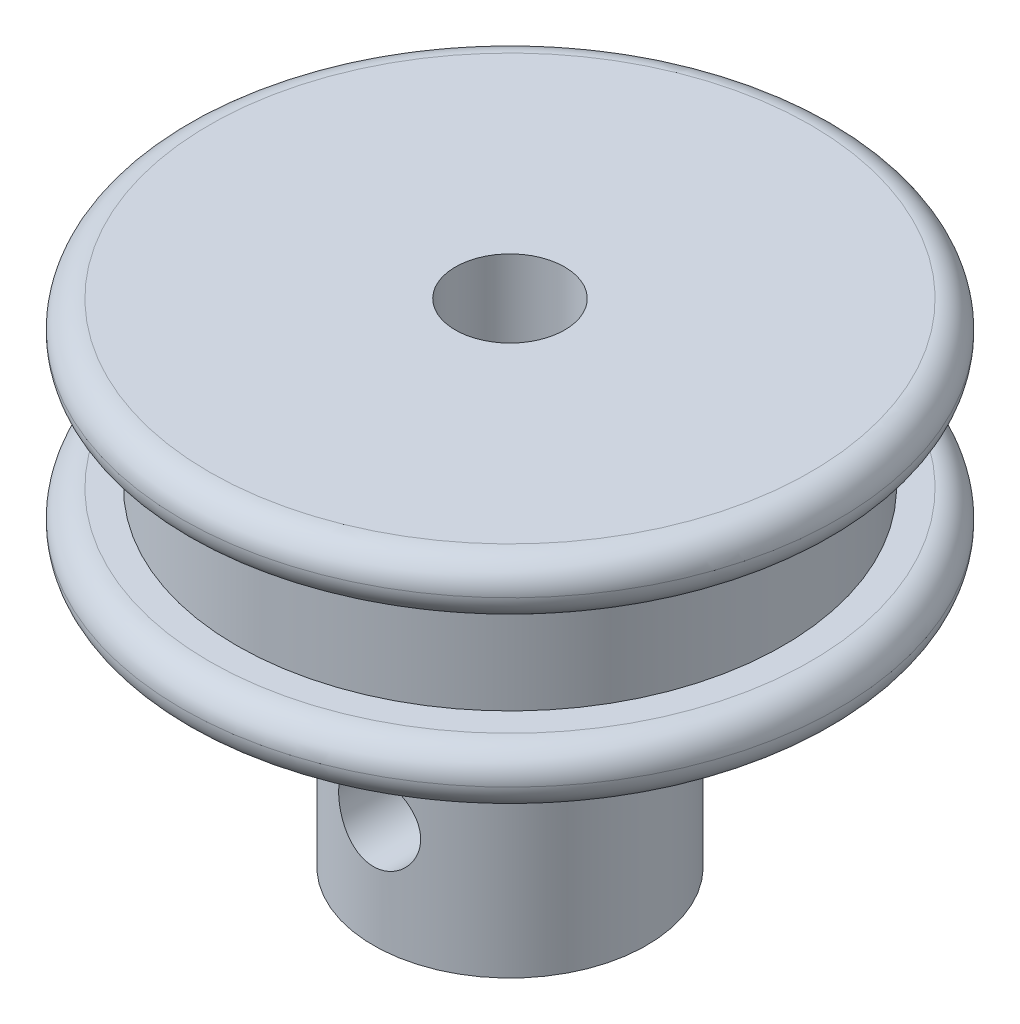
from build123d import *

# Parameters (mm, degrees)
SKETCH_1_R               = 10
EXTRUDE_1_DEPTH          = 4
SKETCH_2_R               = 12
EXTRUDE_2_DEPTH          = 2
EXTRUDE_START            = 2
SKETCH_3_R               = 12
EXTRUDE_3_DEPTH          = 2
SKETCH_4_R               = 5
EXTRUDE_4_DEPTH          = 10
SKETCH_5_R               = 2
CUT_EXTRUDE_1_DEPTH      = 25.738633754
FILLET_2_R               = 1
CUT_EXTRUDE_2_DEPTH      = 10
CUT_EXTRUDE_2_DEPTH_BACK = 10
SKETCH_6_R               = 1.5


with BuildPart() as part:
    # 草图1 → 凸台-拉伸1 (new body)
    with BuildSketch(Plane(origin=(0, 0, 0), x_dir=(1, 0, 0), z_dir=(0, 1, 0))):
        with Locations(Location((0, 0, 0), (0, 0, 270))):
            Circle(SKETCH_1_R)
    extrude(amount=EXTRUDE_1_DEPTH)

    # 草图2 → 凸台-拉伸2 (add)
    with BuildSketch(Plane(origin=(0, 4, 0), x_dir=(1, 0, 0), z_dir=(0, 1, 0))):
        with Locations(Location((0, 0, 0), (0, 0, 270))):
            Circle(SKETCH_2_R)
    extrude(amount=EXTRUDE_2_DEPTH)

    # 草图3 → 凸台-拉伸3 (add)
    with BuildSketch(Plane.XZ.offset(EXTRUDE_START)):
        with Locations(Location((0, 0, 0), (0, 0, 90))):
            Circle(SKETCH_3_R)
    extrude(amount=-EXTRUDE_3_DEPTH)

    # 草图4 → 凸台-拉伸4 (add)
    with BuildSketch(Plane(origin=(0, -2, 0), x_dir=(-1, 0, 0), z_dir=(0, -1, 0))):
        with Locations(Location((0, 0, 0), (0, 0, 90))):
            Circle(SKETCH_4_R)
    extrude(amount=EXTRUDE_4_DEPTH)

    # 草图5 → 切除-拉伸1 (cut, through all)
    with BuildSketch(Plane.XZ.offset(12)):
        with Locations(Location((0, 0, 0), (0, 0, 270))):
            Circle(SKETCH_5_R)
    extrude(amount=-CUT_EXTRUDE_1_DEPTH, mode=Mode.SUBTRACT)

    # 圆角2
    fillet_2_edges = [part.edges().sort_by_distance(p)[0] for p in [
        (0, -2, -12),
        (0, 4, -12),
        (0, 6, -12),
        (0, 0, -12),
    ]]
    fillet(fillet_2_edges, radius=FILLET_2_R - 0.0001)  # a hair under: the kernel refuses the full size

    # 草图6 → 切除-拉伸2 (cut, two sides: drawn at the far end of the back side and taken through both)
    with BuildSketch(Plane.XY.offset(-CUT_EXTRUDE_2_DEPTH_BACK)):
        with Locations((0, -8)):
            Circle(SKETCH_6_R)
    extrude(amount=CUT_EXTRUDE_2_DEPTH + CUT_EXTRUDE_2_DEPTH_BACK, mode=Mode.SUBTRACT)


solid = part.part
